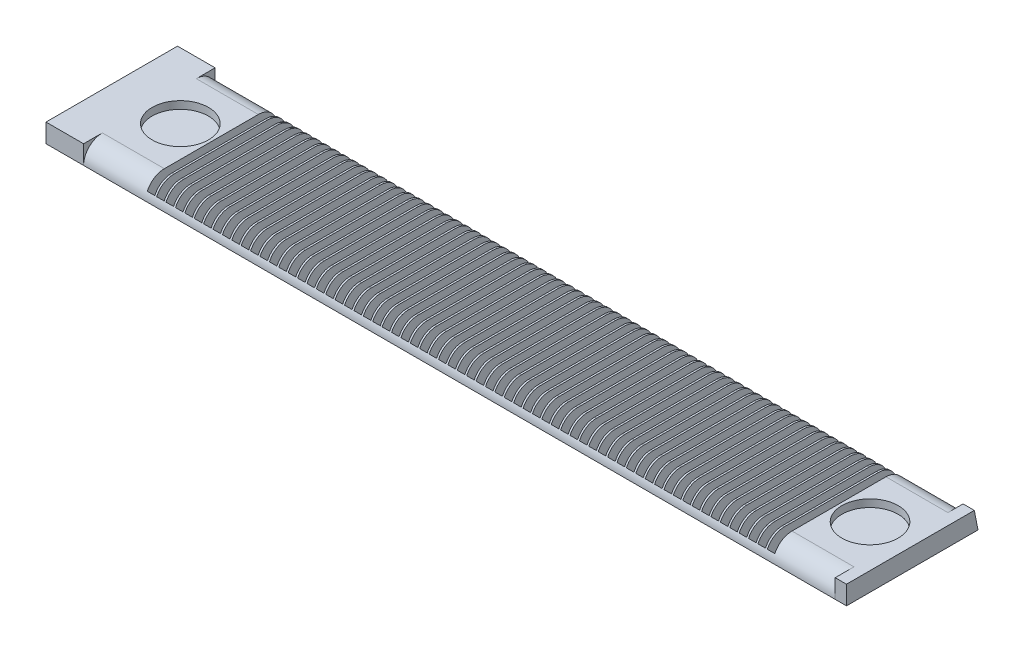
from build123d import *

# Parameters (mm, degrees)
SKETCH1_W           = 200
SKETCH1_H           = 35
BOSS_EXTRUDE4_DEPTH = 5
FILLET1_R           = 5
FILLET2_R           = 5
SKETCH5_R           = 7.5
CUT_EXTRUDE3_DEPTH  = 2
SKETCH6_W           = 2
SKETCH6_H           = 34.34570975
CUT_EXTRUDE4_DEPTH  = 102.642756751
SKETCH7_W           = 10
SKETCH7_H           = 35
EXTRUDE_THIN1_DEPTH = 5
BOSS_EXTRUDE7_DEPTH = 3


with BuildPart() as part:
    # Sketch1 → Boss-Extrude4 (new body)
    with BuildSketch(Plane(origin=(0, 0, 0), x_dir=(1, 0, 0), z_dir=(0, 1, 0))):
        Rectangle(SKETCH1_W, SKETCH1_H)
    extrude(amount=BOSS_EXTRUDE4_DEPTH)

    # Fillet1
    fillet1_edges = [part.edges().sort_by_distance(p)[0] for p in [
        (0, 5, -17.5),
    ]]
    fillet(fillet1_edges, radius=FILLET1_R - 0.0001)  # a hair under: the kernel refuses the full size

    # Fillet2
    fillet2_edges = [part.edges().sort_by_distance(p)[0] for p in [
        (0, 5, 17.5),
    ]]
    fillet(fillet2_edges, radius=FILLET2_R - 0.0001)  # a hair under: the kernel refuses the full size

    # Sketch5 → Cut-Extrude3 (cut)
    with BuildSketch(Plane(origin=(0, 5, 0), x_dir=(1, 0, 0), z_dir=(0, 1, 0))):
        with Locations(Location((-91.764643623, 0, 0), (0, 0, 270))):
            Circle(SKETCH5_R)
        with Locations(Location((91.764643623, 0, 0), (0, 0, 90))):
            Circle(SKETCH5_R)
    extrude(amount=-CUT_EXTRUDE3_DEPTH, mode=Mode.SUBTRACT)

    # Sketch6 → Cut-Extrude4 (cut, through all)
    with BuildSketch(Plane(origin=(0, 5, 0), x_dir=(1, 0, 0), z_dir=(0, 1, 0))):
        with Locations((2.5, 0.120482104)):
            Rectangle(SKETCH6_W, SKETCH6_H)
        with Locations((0, 0.120482104)):
            Rectangle(SKETCH6_W, SKETCH6_H)
        with Locations((5, 0.120482104)):
            Rectangle(SKETCH6_W, SKETCH6_H)
        with Locations((7.5, 0.120482104)):
            Rectangle(SKETCH6_W, SKETCH6_H)
        with Locations((10, 0.120482104)):
            Rectangle(SKETCH6_W, SKETCH6_H)
        with Locations((12.5, 0.120482104)):
            Rectangle(SKETCH6_W, SKETCH6_H)
        with Locations((15, 0.120482104)):
            Rectangle(SKETCH6_W, SKETCH6_H)
        with Locations((17.5, 0.120482104)):
            Rectangle(SKETCH6_W, SKETCH6_H)
        with Locations((20, 0.120482104)):
            Rectangle(SKETCH6_W, SKETCH6_H)
        with Locations((22.5, 0.120482104)):
            Rectangle(SKETCH6_W, SKETCH6_H)
        with Locations((25, 0.120482104)):
            Rectangle(SKETCH6_W, SKETCH6_H)
        with Locations((27.5, 0.120482104)):
            Rectangle(SKETCH6_W, SKETCH6_H)
        with Locations((30, 0.120482104)):
            Rectangle(SKETCH6_W, SKETCH6_H)
        with Locations((32.5, 0.120482104)):
            Rectangle(SKETCH6_W, SKETCH6_H)
        with Locations((35, 0.120482104)):
            Rectangle(SKETCH6_W, SKETCH6_H)
        with Locations((37.5, 0.120482104)):
            Rectangle(SKETCH6_W, SKETCH6_H)
        with Locations((40, 0.120482104)):
            Rectangle(SKETCH6_W, SKETCH6_H)
        with Locations((42.5, 0.120482104)):
            Rectangle(SKETCH6_W, SKETCH6_H)
        with Locations((45, 0.120482104)):
            Rectangle(SKETCH6_W, SKETCH6_H)
        with Locations((47.5, 0.120482104)):
            Rectangle(SKETCH6_W, SKETCH6_H)
        with Locations((50, 0.120482104)):
            Rectangle(SKETCH6_W, SKETCH6_H)
        with Locations((52.5, 0.120482104)):
            Rectangle(SKETCH6_W, SKETCH6_H)
        with Locations((55, 0.120482104)):
            Rectangle(SKETCH6_W, SKETCH6_H)
        with Locations((57.5, 0.120482104)):
            Rectangle(SKETCH6_W, SKETCH6_H)
        with Locations((60, 0.120482104)):
            Rectangle(SKETCH6_W, SKETCH6_H)
        with Locations((62.5, 0.120482104)):
            Rectangle(SKETCH6_W, SKETCH6_H)
        with Locations((65, 0.120482104)):
            Rectangle(SKETCH6_W, SKETCH6_H)
        with Locations((67.5, 0.120482104)):
            Rectangle(SKETCH6_W, SKETCH6_H)
        with Locations((70, 0.120482104)):
            Rectangle(SKETCH6_W, SKETCH6_H)
        with Locations((72.5, 0.120482104)):
            Rectangle(SKETCH6_W, SKETCH6_H)
        with Locations((75, 0.120482104)):
            Rectangle(SKETCH6_W, SKETCH6_H)
        with Locations((77.5, 0.120482104)):
            Rectangle(SKETCH6_W, SKETCH6_H)
        with Locations((80, 0.120482104)):
            Rectangle(SKETCH6_W, SKETCH6_H)
        with Locations((82.5, 0.120482104)):
            Rectangle(SKETCH6_W, SKETCH6_H)
        with Locations((-2.5, 0.120482104)):
            Rectangle(SKETCH6_W, SKETCH6_H)
        with Locations((-5, 0.120482104)):
            Rectangle(SKETCH6_W, SKETCH6_H)
        with Locations((-7.5, 0.120482104)):
            Rectangle(SKETCH6_W, SKETCH6_H)
        with Locations((-10, 0.120482104)):
            Rectangle(SKETCH6_W, SKETCH6_H)
        with Locations((-12.5, 0.120482104)):
            Rectangle(SKETCH6_W, SKETCH6_H)
        with Locations((-15, 0.120482104)):
            Rectangle(SKETCH6_W, SKETCH6_H)
        with Locations((-17.5, 0.120482104)):
            Rectangle(SKETCH6_W, SKETCH6_H)
        with Locations((-20, 0.120482104)):
            Rectangle(SKETCH6_W, SKETCH6_H)
        with Locations((-22.5, 0.120482104)):
            Rectangle(SKETCH6_W, SKETCH6_H)
        with Locations((-25, 0.120482104)):
            Rectangle(SKETCH6_W, SKETCH6_H)
        with Locations((-27.5, 0.120482104)):
            Rectangle(SKETCH6_W, SKETCH6_H)
        with Locations((-30, 0.120482104)):
            Rectangle(SKETCH6_W, SKETCH6_H)
        with Locations((-32.5, 0.120482104)):
            Rectangle(SKETCH6_W, SKETCH6_H)
        with Locations((-35, 0.120482104)):
            Rectangle(SKETCH6_W, SKETCH6_H)
        with Locations((-37.5, 0.120482104)):
            Rectangle(SKETCH6_W, SKETCH6_H)
        with Locations((-40, 0.120482104)):
            Rectangle(SKETCH6_W, SKETCH6_H)
        with Locations((-42.5, 0.120482104)):
            Rectangle(SKETCH6_W, SKETCH6_H)
        with Locations((-45, 0.120482104)):
            Rectangle(SKETCH6_W, SKETCH6_H)
        with Locations((-47.5, 0.120482104)):
            Rectangle(SKETCH6_W, SKETCH6_H)
        with Locations((-50, 0.120482104)):
            Rectangle(SKETCH6_W, SKETCH6_H)
        with Locations((-52.5, 0.120482104)):
            Rectangle(SKETCH6_W, SKETCH6_H)
        with Locations((-55, 0.120482104)):
            Rectangle(SKETCH6_W, SKETCH6_H)
        with Locations((-57.5, 0.120482104)):
            Rectangle(SKETCH6_W, SKETCH6_H)
        with Locations((-60, 0.120482104)):
            Rectangle(SKETCH6_W, SKETCH6_H)
        with Locations((-62.5, 0.120482104)):
            Rectangle(SKETCH6_W, SKETCH6_H)
        with Locations((-65, 0.120482104)):
            Rectangle(SKETCH6_W, SKETCH6_H)
        with Locations((-67.5, 0.120482104)):
            Rectangle(SKETCH6_W, SKETCH6_H)
        with Locations((-70, 0.120482104)):
            Rectangle(SKETCH6_W, SKETCH6_H)
        with Locations((-72.5, 0.120482104)):
            Rectangle(SKETCH6_W, SKETCH6_H)
        with Locations((-75, 0.120482104)):
            Rectangle(SKETCH6_W, SKETCH6_H)
        with Locations((-77.5, 0.120482104)):
            Rectangle(SKETCH6_W, SKETCH6_H)
        with Locations((-80, 0.120482104)):
            Rectangle(SKETCH6_W, SKETCH6_H)
        with Locations((-82.5, 0.120482104)):
            Rectangle(SKETCH6_W, SKETCH6_H)
    extrude(amount=-CUT_EXTRUDE4_DEPTH, mode=Mode.SUBTRACT)

    # Sketch7 → Extrude-Thin1 (add)
    with BuildSketch(Plane(origin=(0, 0, 0), x_dir=(1, 0, 0), z_dir=(0, 1, 0))):
        with Locations((-105, 0)):
            Rectangle(SKETCH7_W, SKETCH7_H)
    extrude(amount=EXTRUDE_THIN1_DEPTH)

    # Sketch8 → Boss-Extrude7 (add)
    with BuildSketch(Plane(origin=(100, 0, 0), x_dir=(0, 0, -1), z_dir=(1, 0, 0))):
        Polygon((-17.5, 0), (17.5, 0), (16.520730704, 5), (15.186572959, 5), (-17.5, 5), align=None)
    extrude(amount=BOSS_EXTRUDE7_DEPTH)


solid = part.part
